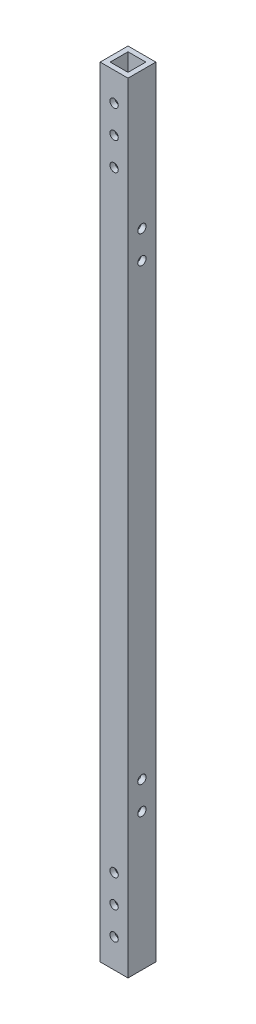
from build123d import *

# Parameters (mm, degrees)
SKETCH_1_W          = 10
SKETCH_1_H          = 10
SKETCH_1_W_2        = 6.4
SKETCH_1_H_2        = 6.4
EXTRUDE_1_DEPTH     = 140
SKETCH_2_R          = 1.5
CUT_EXTRUDE_1_DEPTH = 141.445719052
SKETCH_3_R          = 1.5
CUT_EXTRUDE_2_DEPTH = 141.445719052


with BuildPart() as part:
    # 草图1 → 凸台-拉伸1 (new, symmetric)
    with BuildSketch(Plane(origin=(0, 0, 0), x_dir=(1, 0, 0), z_dir=(0, 1, 0))):
        Rectangle(SKETCH_1_W, SKETCH_1_H)
        Rectangle(SKETCH_1_W_2, SKETCH_1_H_2, mode=Mode.SUBTRACT)
    extrude(amount=EXTRUDE_1_DEPTH, both=True)

    # 草图2 → 切除-拉伸1 (cut, through all)
    with BuildSketch(Plane(origin=(0, 0, -5), x_dir=(-1, 0, 0), z_dir=(0, 0, -1))):
        with Locations((0, -129.7)):
            Circle(SKETCH_2_R)
        with Locations((0, -119.7)):
            Circle(SKETCH_2_R)
        with Locations((0, -109.7)):
            Circle(SKETCH_2_R)
        with Locations((0, 119.7)):
            Circle(SKETCH_2_R)
        with Locations((0, 129.7)):
            Circle(SKETCH_2_R)
        with Locations((0, 109.7)):
            Circle(SKETCH_2_R)
    extrude(amount=-CUT_EXTRUDE_1_DEPTH, mode=Mode.SUBTRACT)

    # 草图3 → 切除-拉伸2 (cut, through all)
    with BuildSketch(Plane.ZY.offset(5)):
        with Locations((0, -90.7)):
            Circle(SKETCH_3_R)
        with Locations((0, -80.7)):
            Circle(SKETCH_3_R)
        with Locations((0, 80.7)):
            Circle(SKETCH_3_R)
        with Locations((0, 90.7)):
            Circle(SKETCH_3_R)
    extrude(amount=-CUT_EXTRUDE_2_DEPTH, mode=Mode.SUBTRACT)


solid = part.part
